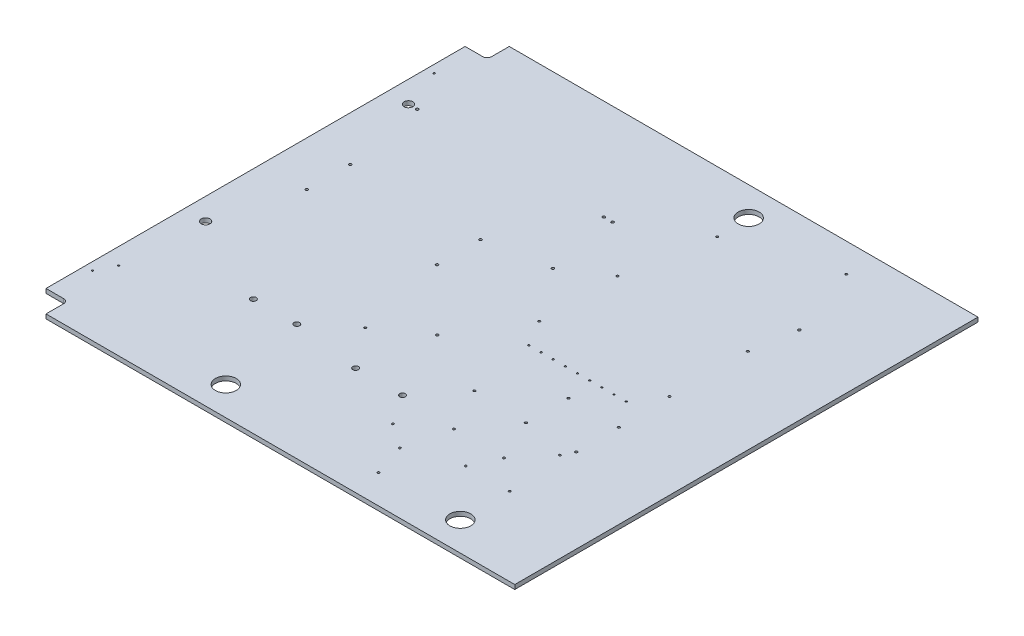
from build123d import *

# Parameters (mm, degrees)
SKETCH1_W                                   = 533.4
SKETCH1_H                                   = 5
BOSS_EXTRUDE1_DEPTH                         = 565.15
BOTTHOMHOLES_SKETCH2_R                      = 12
BOTTOMSTEPPERHOLES_CUT_EXTRUDE1_DEPTH       = 778.132602906
BOTTOMPSUHOLESSKETCH2_R                     = 1.5
BOTTOMPSUHOLESSKETCH2_R_2                   = 3.25
BOTTOMPSUHOLESCUT_EXTRUDE1_DEPTH            = 778.132602906
OCTOPUSHOLESSKETCH2_R                       = 1.35
OCTOPUSMOUNTHOLESCUT_EXTRUDE1_DEPTH         = 778.132602906
POWRCABLEGUIDEMOUNTHOLESSKETCH2_R           = 1.5
POWERCABLEGUIDEMOUNTHOLESCUT_EXTRUDE1_DEPTH = 778.132602906
RPIHOLESSKETCH2_R                           = 1.35
RPIMOUNTHOLESCUT_EXTRUDE1_DEPTH             = 778.132602906
CABLEHOLESSKETCH2_R                         = 5
CABLEHOLESSKETCH2_R_2                       = 1.5
CABLEHOLESSKETCH2_R_3                       = 1
CABLEHOLESCUT_EXTRUDE1_DEPTH                = 778.132602906
SKETCH2_R                                   = 1
OCTOPUSROUTING_HOLESCUT_EXTRUDE1_DEPTH      = 778.132602906
SKETCH3_R                                   = 1.25
CORNERCLAMPHOLECUTS_EXTRUDE1_DEPTH          = 778.132602906
CORNERCABLEKNOTCHCUT_EXTRUDE1_DEPTH         = 778.132602906


with BuildPart() as part:
    # Sketch1 → Boss-Extrude1 (new body)
    with BuildSketch(Plane(origin=(0, 0, 0), x_dir=(0, 0, -1), z_dir=(1, 0, 0))):
        with Locations((-266.7, 2.5)):
            Rectangle(SKETCH1_W, SKETCH1_H)
    extrude(amount=BOSS_EXTRUDE1_DEPTH)

    # BotthomHoles-Sketch2 → BottomStepperHoles-Cut-Extrude1 (cut, through all)
    with BuildSketch(Plane(origin=(0, 5, 0), x_dir=(1, 0, 0), z_dir=(0, 1, 0))):
        with Locations((334.275, -33.175)):
            Circle(BOTTHOMHOLES_SKETCH2_R)
        with Locations((199.275, -500.225)):
            Circle(BOTTHOMHOLES_SKETCH2_R)
        with Locations((469.275, -500.225)):
            Circle(BOTTHOMHOLES_SKETCH2_R)
    extrude(amount=-BOTTOMSTEPPERHOLES_CUT_EXTRUDE1_DEPTH, mode=Mode.SUBTRACT)

    # BottomPSUHolesSketch2 → BottomPSUHolesCut-Extrude1 (cut, through all)
    with BuildSketch(Plane(origin=(0, 5, 0), x_dir=(1, 0, 0), z_dir=(0, 1, 0))):
        with Locations((201.5, -209.2)):
            Circle(BOTTOMPSUHOLESSKETCH2_R)
        with Locations((201.5, -259.2)):
            Circle(BOTTOMPSUHOLESSKETCH2_R)
        with Locations((51.5, -209.2)):
            Circle(BOTTOMPSUHOLESSKETCH2_R)
        with Locations((51.5, -259.2)):
            Circle(BOTTOMPSUHOLESSKETCH2_R)
        with Locations((180, -399.2)):
            Circle(BOTTOMPSUHOLESSKETCH2_R_2)
        with Locations((130, -399.2)):
            Circle(BOTTOMPSUHOLESSKETCH2_R_2)
        with Locations((257.75, -409.2)):
            Circle(BOTTOMPSUHOLESSKETCH2_R_2)
        with Locations((311.75, -409.2)):
            Circle(BOTTOMPSUHOLESSKETCH2_R_2)
    extrude(amount=-BOTTOMPSUHOLESCUT_EXTRUDE1_DEPTH, mode=Mode.SUBTRACT)

    # OctopusHolesSketch2 → OctopusMountHolesCut-Extrude1 (cut, through all)
    with BuildSketch(Plane(origin=(0, 5, 0), x_dir=(1, 0, 0), z_dir=(0, 1, 0))):
        with Locations((316.75, -256.7)):
            Circle(OCTOPUSHOLESSKETCH2_R)
        with Locations((466.75, -256.7)):
            Circle(OCTOPUSHOLESSKETCH2_R)
        with Locations((316.75, -166.7)):
            Circle(OCTOPUSHOLESSKETCH2_R)
        with Locations((466.75, -166.7)):
            Circle(OCTOPUSHOLESSKETCH2_R)
    extrude(amount=-OCTOPUSMOUNTHOLESCUT_EXTRUDE1_DEPTH, mode=Mode.SUBTRACT)

    # PowrCableGuideMountHolesSketch2 → PowerCableGuideMountHolesCut-Extrude1 (cut, through all)
    with BuildSketch(Plane(origin=(0, 5, 0), x_dir=(1, 0, 0), z_dir=(0, 1, 0))):
        with Locations((271.75, -329.2)):
            Circle(POWRCABLEGUIDEMOUNTHOLESSKETCH2_R)
        with Locations((271.75, -196.2)):
            Circle(POWRCABLEGUIDEMOUNTHOLESSKETCH2_R)
    extrude(amount=-POWERCABLEGUIDEMOUNTHOLESCUT_EXTRUDE1_DEPTH, mode=Mode.SUBTRACT)

    # RPIHolesSketch2 → RPIMountHolesCut-Extrude1 (cut, through all)
    with BuildSketch(Plane(origin=(0, 5, 0), x_dir=(1, 0, 0), z_dir=(0, 1, 0))):
        with Locations((468.25, -316.7)):
            Circle(RPIHOLESSKETCH2_R)
        with Locations((468.25, -365.7)):
            Circle(RPIHOLESSKETCH2_R)
        with Locations((410.25, -316.7)):
            Circle(RPIHOLESSKETCH2_R)
        with Locations((410.25, -365.7)):
            Circle(RPIHOLESSKETCH2_R)
    extrude(amount=-RPIMOUNTHOLESCUT_EXTRUDE1_DEPTH, mode=Mode.SUBTRACT)

    # CableHolesSketch2 → CableHolesCut-Extrude1 (cut, through all)
    with BuildSketch(Plane(origin=(0, 5, 0), x_dir=(1, 0, 0), z_dir=(0, 1, 0))):
        with Locations((25, -115.65)):
            Circle(CABLEHOLESSKETCH2_R)
        with Locations((260, -115.65)):
            Circle(CABLEHOLESSKETCH2_R_2)
        with Locations((25, -349.2)):
            Circle(CABLEHOLESSKETCH2_R)
        with Locations((9, -463.4)):
            Circle(CABLEHOLESSKETCH2_R_3)
        with Locations((9, -70)):
            Circle(CABLEHOLESSKETCH2_R_3)
        with Locations((19, -443.4)):
            Circle(CABLEHOLESSKETCH2_R_3)
        with Locations((475, -115.65)):
            Circle(CABLEHOLESSKETCH2_R_2)
        with Locations((250, -115.65)):
            Circle(CABLEHOLESSKETCH2_R_2)
        with Locations((35, -115.65)):
            Circle(CABLEHOLESSKETCH2_R_2)
    extrude(amount=-CABLEHOLESCUT_EXTRUDE1_DEPTH, mode=Mode.SUBTRACT)

    # Sketch2 → OctopusRouting holesCut-Extrude1 (cut, through all)
    with BuildSketch(Plane(origin=(0, 5, 0), x_dir=(1, 0, 0), z_dir=(0, 1, 0))):
        with Locations((334.75, -286.7)):
            Circle(SKETCH2_R)
        with Locations((348.75, -286.7)):
            Circle(SKETCH2_R)
        with Locations((362.75, -286.7)):
            Circle(SKETCH2_R)
        with Locations((376.75, -286.7)):
            Circle(SKETCH2_R)
        with Locations((390.75, -286.7)):
            Circle(SKETCH2_R)
        with Locations((404.75, -286.7)):
            Circle(SKETCH2_R)
        with Locations((418.75, -286.7)):
            Circle(SKETCH2_R)
        with Locations((432.75, -286.7)):
            Circle(SKETCH2_R)
        with Locations((446.75, -286.7)):
            Circle(SKETCH2_R)
    extrude(amount=-OCTOPUSROUTING_HOLESCUT_EXTRUDE1_DEPTH, mode=Mode.SUBTRACT)

    # Sketch3 → CornerClampHoleCuts-Extrude1 (cut, through all)
    with BuildSketch(Plane(origin=(0, 5, 0), x_dir=(1, 0, 0), z_dir=(0, 1, 0))):
        with Locations((469.275, -443.4)):
            Circle(SKETCH3_R)
        with Locations((418.75, -443.4)):
            Circle(SKETCH3_R)
        with Locations((432.75, -413.4)):
            Circle(SKETCH3_R)
        with Locations((375, -413.4)):
            Circle(SKETCH3_R)
        with Locations((375, -500.225)):
            Circle(SKETCH3_R)
        with Locations((362.75, -463.4)):
            Circle(SKETCH3_R)
        with Locations((334.75, -443.4)):
            Circle(SKETCH3_R)
        with Locations((446.75, -33.175)):
            Circle(SKETCH3_R)
        with Locations((334.75, -70)):
            Circle(SKETCH3_R)
        with Locations((348.75, -363.4)):
            Circle(SKETCH3_R)
        with Locations((223, -363.4)):
            Circle(SKETCH3_R)
        with Locations((462, -378.4)):
            Circle(SKETCH3_R)
    extrude(amount=-CORNERCLAMPHOLECUTS_EXTRUDE1_DEPTH, mode=Mode.SUBTRACT)

    # CornerCableKnotchesSketch4 → CornerCableKnotchCut-Extrude1 (cut, through all)
    with BuildSketch(Plane(origin=(0, 5, 0), x_dir=(1, 0, 0), z_dir=(0, 1, 0))):
        with BuildLine():
            Line((0, -25.4), (20.4, -25.4))
            ThreePointArc((20.4, -25.4), (23.935533906, -23.935533906), (25.4, -20.4))
            Line((25.4, -20.4), (25.4, 0))
            Line((25.4, 0), (0, 0))
            Line((0, 0), (0, -25.4))
        make_face()
        with BuildLine():
            Line((0, -508), (20.4, -508))
            ThreePointArc((20.4, -508), (23.935533906, -509.464466094), (25.4, -513))
            Line((25.4, -513), (25.4, -533.4))
            Line((25.4, -533.4), (0, -533.4))
            Line((0, -533.4), (0, -508))
        make_face()
    extrude(amount=-CORNERCABLEKNOTCHCUT_EXTRUDE1_DEPTH, mode=Mode.SUBTRACT)


solid = part.part
